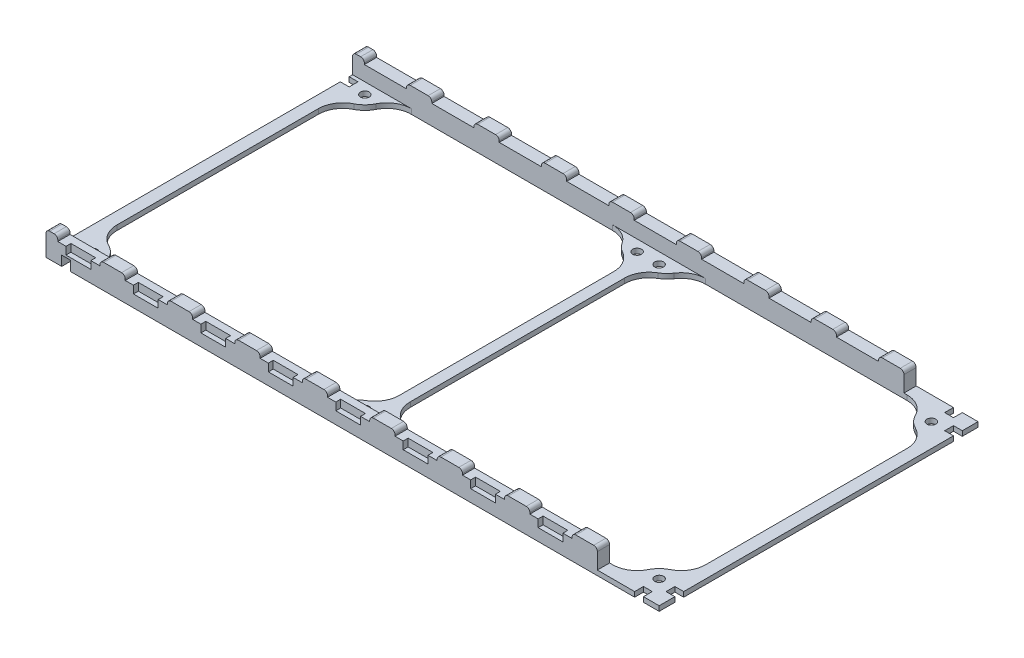
from build123d import *

# Parameters (mm, degrees)
SKETCH1_W                                  = 250
SKETCH1_H                                  = 130
SKETCH1_W_2                                = 240
SKETCH1_H_2                                = 120
BOSS_EXTRUDE1_DEPTH                        = 2
SKETCH2_W                                  = 9
SKETCH2_H                                  = 9
SKETCH2_R                                  = 1.8
SKETCH2_W_2                                = 18
BOSS_EXTRUDE2_DEPTH                        = 2
FILLET1_R                                  = 10
FILLET2_R                                  = 10
SKETCH3_W                                  = 4.493162566
SKETCH3_H                                  = 102
BOSS_EXTRUDE3_DEPTH                        = 2
FILLET3_R                                  = 10
SKETCH4_W                                  = 17.2
SKETCH4_H                                  = 5
BOSS_EXTRUDE4_DEPTH                        = 6
SKETCH5_W                                  = 10.3
SKETCH5_H                                  = 5
BOSS_EXTRUDE5_DEPTH                        = 8
FILLET4_R                                  = 1.5
SKETCH6_W                                  = 4.8
SKETCH6_H                                  = 5
BOSS_EXTRUDE6_DEPTH                        = 8
SKETCH10_W                                 = 10.1
SKETCH10_H                                 = 3.1
CUT_EXTRUDE2_DEPTH                         = 2
LPATTERN1_COUNT                            = 8
LPATTERN1_PITCH                            = 27.5
FILLET4_OF_LPATTERN1_R                     = 1.5
FILLET5_R                                  = 1.5
SKETCH9_W                                  = 3.6
SKETCH9_H                                  = 3.6
CUT_EXTRUDE1_DEPTH                         = 4
MIRROR1_AT_THE_SECOND_PLANE_COPY_1_SKETC_W = 3.6
MIRROR1_AT_THE_SECOND_PLANE_COPY_1_SKETC_H = 3.6
MIRROR1_AT_THE_SECOND_PLANE_COPY_1_DEPTH   = 4
LPATTERN2_COUNT                            = 8
LPATTERN2_PITCH                            = 27.5


with BuildPart() as part:
    # Sketch1 → Boss-Extrude1 (new body)
    with BuildSketch(Plane(origin=(0, 0, 0), x_dir=(1, 0, 0), z_dir=(0, 1, 0))):
        with Locations((125, 65)):
            Rectangle(SKETCH1_W, SKETCH1_H)
        with Locations((125, 65)):
            Rectangle(SKETCH1_W_2, SKETCH1_H_2, mode=Mode.SUBTRACT)
    extrude(amount=BOSS_EXTRUDE1_DEPTH)

    # Sketch2 → Boss-Extrude2 (add)
    # profile 1 of 6: a face of its own
    with BuildSketch(Plane(origin=(0, 0, 0), x_dir=(1, 0, 0), z_dir=(0, 1, 0))):
        with Locations((9.5, 9.5)):
            Rectangle(SKETCH2_W, SKETCH2_H)
        with Locations(Location((9.5, 9.5, 0), (0, 0, 270))):
            Circle(SKETCH2_R, mode=Mode.SUBTRACT)
    # profile 2 of 6: a face of its own
    with BuildSketch(Plane(origin=(0, 0, 0), x_dir=(1, 0, 0), z_dir=(0, 1, 0))):
        with Locations((9.5, 120.5)):
            Rectangle(SKETCH2_W, SKETCH2_H)
        with Locations(Location((9.5, 120.5, 0), (0, 0, 270))):
            Circle(SKETCH2_R, mode=Mode.SUBTRACT)
    # profile 3 of 6: a face of its own
    with BuildSketch(Plane(origin=(0, 0, 0), x_dir=(1, 0, 0), z_dir=(0, 1, 0))):
        Polygon((116, 125), (125, 125), (134, 125), (134, 116), (125, 116), (116, 116), align=None)
        with Locations(Location((120.5, 120.5, 0), (0, 0, 270))):
            Circle(SKETCH2_R, mode=Mode.SUBTRACT)
        with Locations(Location((129.5, 120.5, 0), (0, 0, 270))):
            Circle(SKETCH2_R, mode=Mode.SUBTRACT)
    # profile 4 of 6: a face of its own
    with BuildSketch(Plane(origin=(0, 0, 0), x_dir=(1, 0, 0), z_dir=(0, 1, 0))):
        with Locations((125, 9.5)):
            Rectangle(SKETCH2_W_2, SKETCH2_H)
        with Locations(Location((120.5, 9.5, 0), (0, 0, 270))):
            Circle(SKETCH2_R, mode=Mode.SUBTRACT)
        with Locations(Location((129.5, 9.5, 0), (0, 0, 270))):
            Circle(SKETCH2_R, mode=Mode.SUBTRACT)
    # profile 5 of 6: a face of its own
    with BuildSketch(Plane(origin=(0, 0, 0), x_dir=(1, 0, 0), z_dir=(0, 1, 0))):
        with Locations((240.5, 120.5)):
            Rectangle(SKETCH2_W, SKETCH2_H)
        with Locations(Location((240.5, 120.5, 0), (0, 0, 270))):
            Circle(SKETCH2_R, mode=Mode.SUBTRACT)
    # profile 6 of 6: a face of its own
    with BuildSketch(Plane(origin=(0, 0, 0), x_dir=(1, 0, 0), z_dir=(0, 1, 0))):
        with Locations((240.5, 9.5)):
            Rectangle(SKETCH2_W, SKETCH2_H)
        with Locations(Location((240.5, 9.5, 0), (0, 0, 270))):
            Circle(SKETCH2_R, mode=Mode.SUBTRACT)
    extrude(amount=BOSS_EXTRUDE2_DEPTH)

    # Fillet1
    # the kernel refuses this fillet: 10 mm, written as the material it adds along each edge
    with BuildSketch(Plane(origin=(5, 0, -14), x_dir=(0, 0, -1), z_dir=(0, 1, 0)), Plane(origin=(14, 0, -125), x_dir=(1, 0, 0), z_dir=(0, 1, 0)), Plane(origin=(134, 0, -125), x_dir=(1, 0, 0), z_dir=(0, 1, 0)), Plane(origin=(245, 0, -116), x_dir=(0, 0, 1), z_dir=(0, 1, 0)), Plane(origin=(236, 0, -5), x_dir=(-1, 0, 0), z_dir=(0, 1, 0)), Plane(origin=(116, 0, -5), x_dir=(-1, 0, 0), z_dir=(0, 1, 0))) as fillet1_piece_1:
        with BuildLine():
            CenterArc((9.949874371, -10), FILLET1_R, 90, 84.260829523)
            Line((0, -9), (-0.198997487, -8.98))
            ThreePointArc((-0.198997487, -8.98), (-0.2, -4.5), (-0.2, 0))
            Line((-0.2, 0), (0, 0.2))
            Line((0, 0.2), (9.949874371, 0.2))
            Line((9.949874371, 0.2), (9.949874371, 0))
        make_face()
    extrude(amount=2)
    with BuildSketch(Plane(origin=(14, 0, -5), x_dir=(1, 0, 0), z_dir=(0, 1, 0)), Plane(origin=(5, 0, -116), x_dir=(0, 0, 1), z_dir=(0, 1, 0)), Plane(origin=(116, 0, -125), x_dir=(-1, 0, 0), z_dir=(0, 1, 0)), Plane(origin=(236, 0, -125), x_dir=(-1, 0, 0), z_dir=(0, 1, 0)), Plane(origin=(245, 0, -14), x_dir=(0, 0, -1), z_dir=(0, 1, 0)), Plane(origin=(134, 0, -5), x_dir=(1, 0, 0), z_dir=(0, 1, 0))) as fillet1_piece_2:
        with BuildLine():
            CenterArc((9.949874371, 10), FILLET1_R, 185.739170477, 84.260829523)
            Line((0, 9), (-0.198997487, 8.98))
            ThreePointArc((-0.198997487, 8.98), (-0.2, 4.5), (-0.2, 0))
            Line((-0.2, 0), (0, -0.2))
            Line((0, -0.2), (9.949874371, -0.2))
            Line((9.949874371, -0.2), (9.949874371, 0))
        make_face()
    extrude(amount=2)

    # Fillet2
    fillet2_edges = [part.edges().sort_by_distance(p)[0] for p in [
        (14, 1, -14),
        (14, 1, -116),
        (236, 1, -116),
        (236, 1, -14),
        (116, 1, -116),
        (134, 1, -116),
        (116, 1, -14),
        (134, 1, -14),
    ]]
    fillet(fillet2_edges, radius=FILLET2_R)

    # Sketch3 → Boss-Extrude3 (add)
    with BuildSketch(Plane(origin=(0, 0, 0), x_dir=(1, 0, 0), z_dir=(0, 1, 0))):
        with Locations((125, 65)):
            Rectangle(SKETCH3_W, SKETCH3_H)
    extrude(amount=BOSS_EXTRUDE3_DEPTH)

    # Fillet3
    fillet3_edges = [part.edges().sort_by_distance(p)[0] for p in [
        (127.246581283, 1, -14),
        (122.753418717, 1, -14),
        (122.753418717, 1, -116),
        (127.246581283, 1, -116),
    ]]
    fillet(fillet3_edges, radius=FILLET3_R)

    # Sketch4 → Boss-Extrude4 (add)
    with BuildSketch(Plane(origin=(0, 2, 0), x_dir=(1, 0, 0), z_dir=(0, 1, 0))):
        with Locations((13.4, 2.5)):
            Rectangle(SKETCH4_W, SKETCH4_H)
        with Locations((13.4, 127.5)):
            Rectangle(SKETCH4_W, SKETCH4_H)
    boss_extrude4 = extrude(amount=BOSS_EXTRUDE4_DEPTH)

    # Sketch5 → Boss-Extrude5 (add)
    with BuildSketch(Plane(origin=(0, 2, 0), x_dir=(1, 0, 0), z_dir=(0, 1, 0))):
        with Locations((27.15, 127.5)):
            Rectangle(SKETCH5_W, SKETCH5_H)
        with Locations((27.15, 2.5)):
            Rectangle(SKETCH5_W, SKETCH5_H)
    boss_extrude5 = extrude(amount=BOSS_EXTRUDE5_DEPTH)

    # Fillet4
    fillet4_edges = [part.edges().sort_by_distance(p)[0] for p in [
        (22, 10, -127.5),
        (32.3, 10, -127.5),
        (22, 10, -2.5),
        (32.3, 10, -2.5),
    ]]
    fillet(fillet4_edges, radius=FILLET4_R)

    # Sketch6 → Boss-Extrude6 (add)
    with BuildSketch(Plane(origin=(0, 2, 0), x_dir=(1, 0, 0), z_dir=(0, 1, 0))):
        with Locations((2.4, 127.5)):
            Rectangle(SKETCH6_W, SKETCH6_H)
        with Locations((2.4, 2.5)):
            Rectangle(SKETCH6_W, SKETCH6_H)
    extrude(amount=BOSS_EXTRUDE6_DEPTH)

    # Sketch10 → Cut-Extrude2 (cut)
    with BuildSketch(Plane.XY):
        with Locations((13.2, 6.45)):
            Rectangle(SKETCH10_W, SKETCH10_H)
    cut_extrude2 = extrude(amount=-CUT_EXTRUDE2_DEPTH, mode=Mode.SUBTRACT)

    # LPattern1: Boss-Extrude4, Boss-Extrude5 ×8
    with Locations(*[(i * LPATTERN1_PITCH, 0, 0) for i in range(1, LPATTERN1_COUNT)]):
        add(boss_extrude4)
        add(boss_extrude5)

    # Fillet4 of LPattern1
    fillet4_of_lpattern1_edges = [part.edges().sort_by_distance(p)[0] for p in [
        (49.5, 10, -127.5),
        (59.8, 10, -127.5),
        (49.5, 10, -2.5),
        (59.8, 10, -2.5),
        (77, 10, -127.5),
        (87.3, 10, -127.5),
        (77, 10, -2.5),
        (87.3, 10, -2.5),
        (104.5, 10, -127.5),
        (114.8, 10, -127.5),
        (104.5, 10, -2.5),
        (114.8, 10, -2.5),
        (132, 10, -127.5),
        (142.3, 10, -127.5),
        (132, 10, -2.5),
        (142.3, 10, -2.5),
        (159.5, 10, -127.5),
        (169.8, 10, -127.5),
        (159.5, 10, -2.5),
        (169.8, 10, -2.5),
        (187, 10, -127.5),
        (197.3, 10, -127.5),
        (187, 10, -2.5),
        (197.3, 10, -2.5),
        (214.5, 10, -127.5),
        (224.8, 10, -127.5),
        (214.5, 10, -2.5),
        (224.8, 10, -2.5),
    ]]
    fillet(fillet4_of_lpattern1_edges, radius=FILLET4_OF_LPATTERN1_R)

    # Fillet5
    fillet5_edges = [part.edges().sort_by_distance(p)[0] for p in [
        (0, 10, -127.5),
        (4.8, 10, -127.5),
        (0, 10, -2.5),
        (4.8, 10, -2.5),
    ]]
    fillet(fillet5_edges, radius=FILLET5_R)

    # Sketch9 → Cut-Extrude1 (cut)
    with BuildSketch(Plane(origin=(0, 0, 0), x_dir=(1, 0, 0), z_dir=(0, 1, 0))):
        with Locations((8.2, 1.8)):
            Rectangle(SKETCH9_W, SKETCH9_H)
        with Locations((1.8, 8.2)):
            Rectangle(SKETCH9_W, SKETCH9_H)
    cut_extrude1 = extrude(amount=CUT_EXTRUDE1_DEPTH, mode=Mode.SUBTRACT)

    # Mirror1: Cut-Extrude1 across plane
    add(cut_extrude1.mirror(Plane.XY.offset(-65)), mode=Mode.SUBTRACT)

    # Mirror1 at the second plane: Cut-Extrude1 across plane
    add(cut_extrude1.mirror(Plane.ZY.offset(-125)), mode=Mode.SUBTRACT)

    # Mirror1 at the second plane copy 1 sketc → Mirror1 at the second plane copy 1 (cut)
    with BuildSketch(Plane(origin=(250, 0, -130), x_dir=(-1, 0, 0), z_dir=(0, 1, 0))):
        with Locations((8.2, 1.8)):
            Rectangle(MIRROR1_AT_THE_SECOND_PLANE_COPY_1_SKETC_W, MIRROR1_AT_THE_SECOND_PLANE_COPY_1_SKETC_H)
        with Locations((1.8, 8.2)):
            Rectangle(MIRROR1_AT_THE_SECOND_PLANE_COPY_1_SKETC_W, MIRROR1_AT_THE_SECOND_PLANE_COPY_1_SKETC_H)
    extrude(amount=MIRROR1_AT_THE_SECOND_PLANE_COPY_1_DEPTH, mode=Mode.SUBTRACT)

    # LPattern2: Cut-Extrude2 ×8
    with Locations(*[(i * LPATTERN2_PITCH, 0, 0) for i in range(1, LPATTERN2_COUNT)]):
        add(cut_extrude2, mode=Mode.SUBTRACT)


solid = part.part
